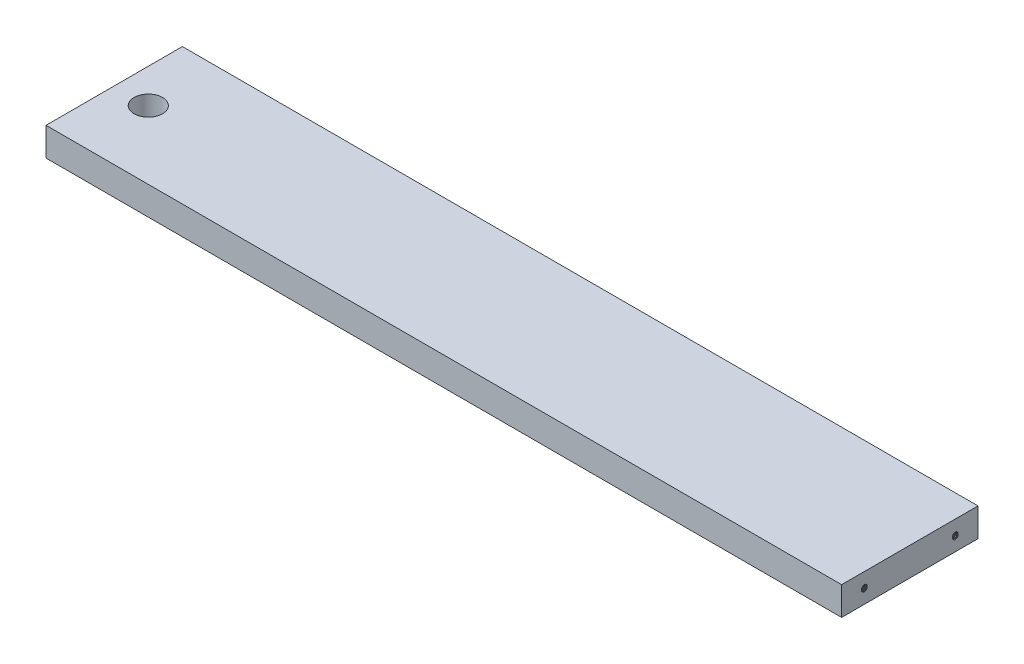
from build123d import *

# Parameters (mm, degrees)
SKETCH1_W                      = 700
SKETCH1_H                      = 120
BOSS_EXTRUDE1_DEPTH            = 25
SKETCH2_R                      = 12.5
CUT_EXTRUDE1_DEPTH             = 356.984550227
F_8_0_199_DIAMETER_HOLE1_D     = 5.0546
F_8_0_199_DIAMETER_HOLE1_DEPTH = 20
F_8_0_199_DIAMETER_HOLE1_TIP   = 1.518555042
CUT_SWEEP1_PITCH               = 1.25
CUT_SWEEP2_PITCH               = 1.25


with BuildPart() as part:
    # Sketch1 → Boss-Extrude1 (new body)
    with BuildSketch(Plane(origin=(0, 0, 0), x_dir=(1, 0, 0), z_dir=(0, 1, 0))):
        Rectangle(SKETCH1_W, SKETCH1_H)
    extrude(amount=BOSS_EXTRUDE1_DEPTH)

    # Sketch2 → Cut-Extrude1 (cut, through all)
    with BuildSketch(Plane(origin=(0, 25, 0), x_dir=(1, 0, 0), z_dir=(0, 1, 0))):
        with Locations(Location((-320, 0, 0), (0, 0, 270))):
            Circle(SKETCH2_R)
    extrude(amount=-CUT_EXTRUDE1_DEPTH, mode=Mode.SUBTRACT)

    # #8 (0.199) Diameter Hole1
    with Locations(Plane(origin=(350, 0, 0), x_dir=(0, 0, -1), z_dir=(1, 0, 0))):
        with Locations((-40, 12.5), (40, 12.5)):
            Hole(F_8_0_199_DIAMETER_HOLE1_D / 2, depth=F_8_0_199_DIAMETER_HOLE1_DEPTH)
            with Locations((0, 0, -(F_8_0_199_DIAMETER_HOLE1_DEPTH + F_8_0_199_DIAMETER_HOLE1_TIP / 2))):  # 118° drill point
                Cone(0, F_8_0_199_DIAMETER_HOLE1_D / 2, F_8_0_199_DIAMETER_HOLE1_TIP, mode=Mode.SUBTRACT)

    # Cut-Sweep1: arcs per turn and ends read off the stored shape
    # Cut-Sweep1: the profile of Sketch31 profile screwed along a right-hand helix through 19.25 turns, 8 arcs to a turn; built about Z, then put on its axis
    cut_sweep1_z = Axis((0, 0, 0), (0, 0, 1))
    cut_sweep1_corners = [(2.527, 0, -1.562673205), (2.527, 0, -0.937326795), (3.068565877, 0, -1.25)]
    with BuildLine(mode=Mode.PRIVATE) as cut_sweep1_profile:
        Line(cut_sweep1_corners[0], cut_sweep1_corners[1])
        Line(cut_sweep1_corners[1], cut_sweep1_corners[2])
        Line(cut_sweep1_corners[2], cut_sweep1_corners[0])
    cut_sweep1_cap = Face(cut_sweep1_profile.wire())
    cut_sweep1_turn_angles = [0, 22.5, 45, 67.5, 90, 112.5, 135, 157.5, 180, 202.5, 225, 247.5, 270, 292.5, 315, 337.5, 360]
    cut_sweep1_turn_weights = [1, 0.9238795325112867, 1, 0.9238795325112867, 1, 0.9238795325112867, 1, 0.9238795325112867, 1, 0.9238795325112867, 1, 0.9238795325112867, 1, 0.9238795325112867, 1, 0.9238795325112867, 1]
    cut_sweep1_turn_rails = [Edge.make_bspline([Vector(p[0], p[1], 0).rotate(cut_sweep1_z, cut_sweep1_turn_angles[k]) / cut_sweep1_turn_weights[k] + Vector(0, 0, p[2] + CUT_SWEEP1_PITCH * cut_sweep1_turn_angles[k] / 360) for k in range(17)], [0, 0, 0, 1, 1, 2, 2, 3, 3, 4, 4, 5, 5, 6, 6, 7, 7, 8, 8, 8], 2, cut_sweep1_turn_weights) for p in cut_sweep1_corners]
    cut_sweep1_turn_sides = [Face.make_surface_from_curves(cut_sweep1_turn_rails[p[0]], cut_sweep1_turn_rails[p[1]]) for p in [(0, 1), (1, 2), (2, 0)]]
    cut_sweep1_last_angles = [6840, 6862.5, 6885, 6907.5, 6930]
    cut_sweep1_last_weights = [1, 0.9238795325112867, 1, 0.9238795325112867, 1]
    cut_sweep1_last_rails = [Edge.make_bspline([Vector(p[0], p[1], 0).rotate(cut_sweep1_z, cut_sweep1_last_angles[k]) / cut_sweep1_last_weights[k] + Vector(0, 0, p[2] + CUT_SWEEP1_PITCH * cut_sweep1_last_angles[k] / 360) for k in range(5)], [0, 0, 0, 1, 1, 2, 2, 2], 2, cut_sweep1_last_weights) for p in cut_sweep1_corners]
    cut_sweep1_last_sides = [Face.make_surface_from_curves(cut_sweep1_last_rails[p[0]], cut_sweep1_last_rails[p[1]]) for p in [(0, 1), (1, 2), (2, 0)]]
    cut_sweep1 = Plane(origin=(350, 12.5, 40), x_dir=(0, -1, 0), z_dir=(-1, 0, 0)) * Solid(Shell([*[p.moved(Location((0, 0, CUT_SWEEP1_PITCH * i))) for i in range(19) for p in cut_sweep1_turn_sides], *cut_sweep1_last_sides, cut_sweep1_cap, cut_sweep1_cap.rotate(cut_sweep1_z, 6930).moved(Location((0, 0, CUT_SWEEP1_PITCH * 6930 / 360)))]))
    add(cut_sweep1, mode=Mode.SUBTRACT)

    # Cut-Sweep2: arcs per turn and ends read off the stored shape
    # Cut-Sweep2: the profile of Sketch33 screwed along a right-hand helix through 17.25 turns, 8 arcs to a turn; built about Z, then put on its axis
    cut_sweep2_z = Axis((0, 0, 0), (0, 0, 1))
    cut_sweep2_corners = [(2.526843927, 0, -1.614579541), (2.526843927, 0, -0.892891704), (3.151843927, 0, -1.253735622)]
    with BuildLine(mode=Mode.PRIVATE) as cut_sweep2_profile:
        Line(cut_sweep2_corners[0], cut_sweep2_corners[1])
        Line(cut_sweep2_corners[1], cut_sweep2_corners[2])
        Line(cut_sweep2_corners[2], cut_sweep2_corners[0])
    cut_sweep2_cap = Face(cut_sweep2_profile.wire())
    cut_sweep2_turn_angles = [0, 22.5, 45, 67.5, 90, 112.5, 135, 157.5, 180, 202.5, 225, 247.5, 270, 292.5, 315, 337.5, 360]
    cut_sweep2_turn_weights = [1, 0.9238795325112867, 1, 0.9238795325112867, 1, 0.9238795325112867, 1, 0.9238795325112867, 1, 0.9238795325112867, 1, 0.9238795325112867, 1, 0.9238795325112867, 1, 0.9238795325112867, 1]
    cut_sweep2_turn_rails = [Edge.make_bspline([Vector(p[0], p[1], 0).rotate(cut_sweep2_z, cut_sweep2_turn_angles[k]) / cut_sweep2_turn_weights[k] + Vector(0, 0, p[2] + CUT_SWEEP2_PITCH * cut_sweep2_turn_angles[k] / 360) for k in range(17)], [0, 0, 0, 1, 1, 2, 2, 3, 3, 4, 4, 5, 5, 6, 6, 7, 7, 8, 8, 8], 2, cut_sweep2_turn_weights) for p in cut_sweep2_corners]
    cut_sweep2_turn_sides = [Face.make_surface_from_curves(cut_sweep2_turn_rails[p[0]], cut_sweep2_turn_rails[p[1]]) for p in [(0, 1), (1, 2), (2, 0)]]
    cut_sweep2_last_angles = [6120, 6142.5, 6165, 6187.5, 6210]
    cut_sweep2_last_weights = [1, 0.9238795325112867, 1, 0.9238795325112867, 1]
    cut_sweep2_last_rails = [Edge.make_bspline([Vector(p[0], p[1], 0).rotate(cut_sweep2_z, cut_sweep2_last_angles[k]) / cut_sweep2_last_weights[k] + Vector(0, 0, p[2] + CUT_SWEEP2_PITCH * cut_sweep2_last_angles[k] / 360) for k in range(5)], [0, 0, 0, 1, 1, 2, 2, 2], 2, cut_sweep2_last_weights) for p in cut_sweep2_corners]
    cut_sweep2_last_sides = [Face.make_surface_from_curves(cut_sweep2_last_rails[p[0]], cut_sweep2_last_rails[p[1]]) for p in [(0, 1), (1, 2), (2, 0)]]
    cut_sweep2 = Plane(origin=(350, 12.5, -40), x_dir=(0, -1, 0), z_dir=(-1, 0, 0)) * Solid(Shell([*[p.moved(Location((0, 0, CUT_SWEEP2_PITCH * i))) for i in range(17) for p in cut_sweep2_turn_sides], *cut_sweep2_last_sides, cut_sweep2_cap, cut_sweep2_cap.rotate(cut_sweep2_z, 6210).moved(Location((0, 0, CUT_SWEEP2_PITCH * 6210 / 360)))]))
    add(cut_sweep2, mode=Mode.SUBTRACT)


solid = part.part
